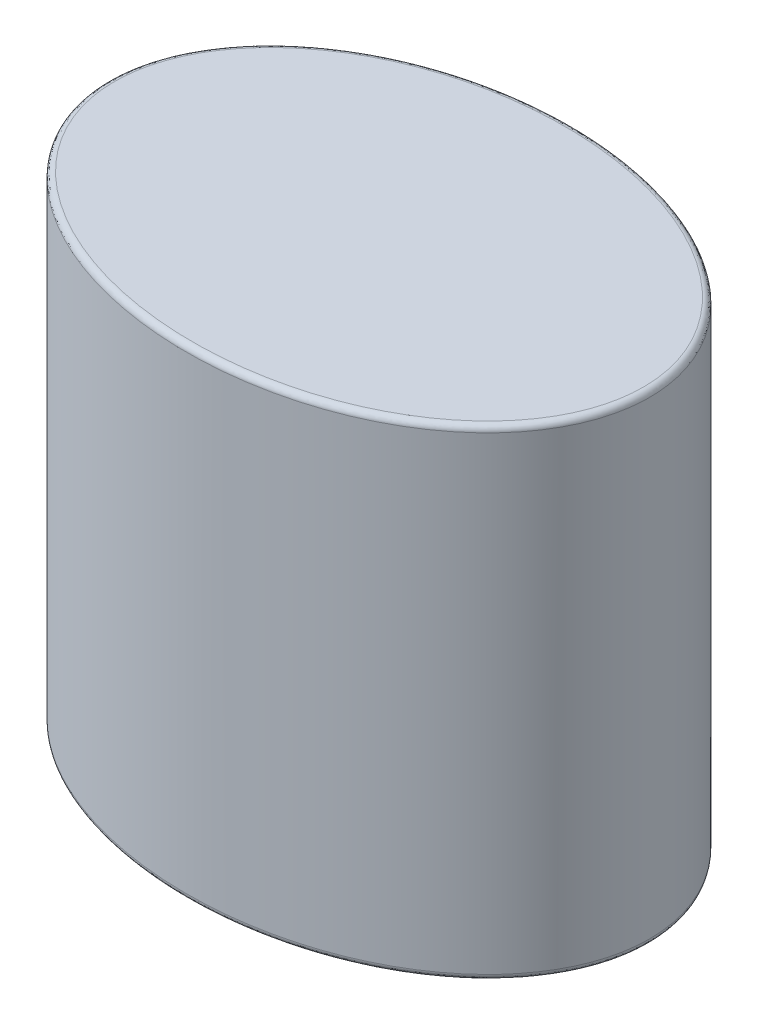
from build123d import *

# Parameters (mm, degrees)
SKETCH1_RX          = 22.5
SKETCH1_RY          = 16
BOSS_EXTRUDE1_DEPTH = 40
FILLET2_R           = 0.5


with BuildPart() as part:
    # Sketch1 → Boss-Extrude1 (new body)
    with BuildSketch(Plane(origin=(0, 0, 0), x_dir=(1, 0, 0), z_dir=(0, 1, 0))):
        with Locations(Location((0, 0), (0, 0, 180))):
            Ellipse(SKETCH1_RX, SKETCH1_RY)
    extrude(amount=BOSS_EXTRUDE1_DEPTH)

    # Fillet2
    fillet2_edges = [part.edges().sort_by_distance(p)[0] for p in [
        (22.499995884, 40, -0.00967762),
        (22.499995884, 0, -0.00967762),
    ]]
    fillet(fillet2_edges, radius=FILLET2_R)


solid = part.part
